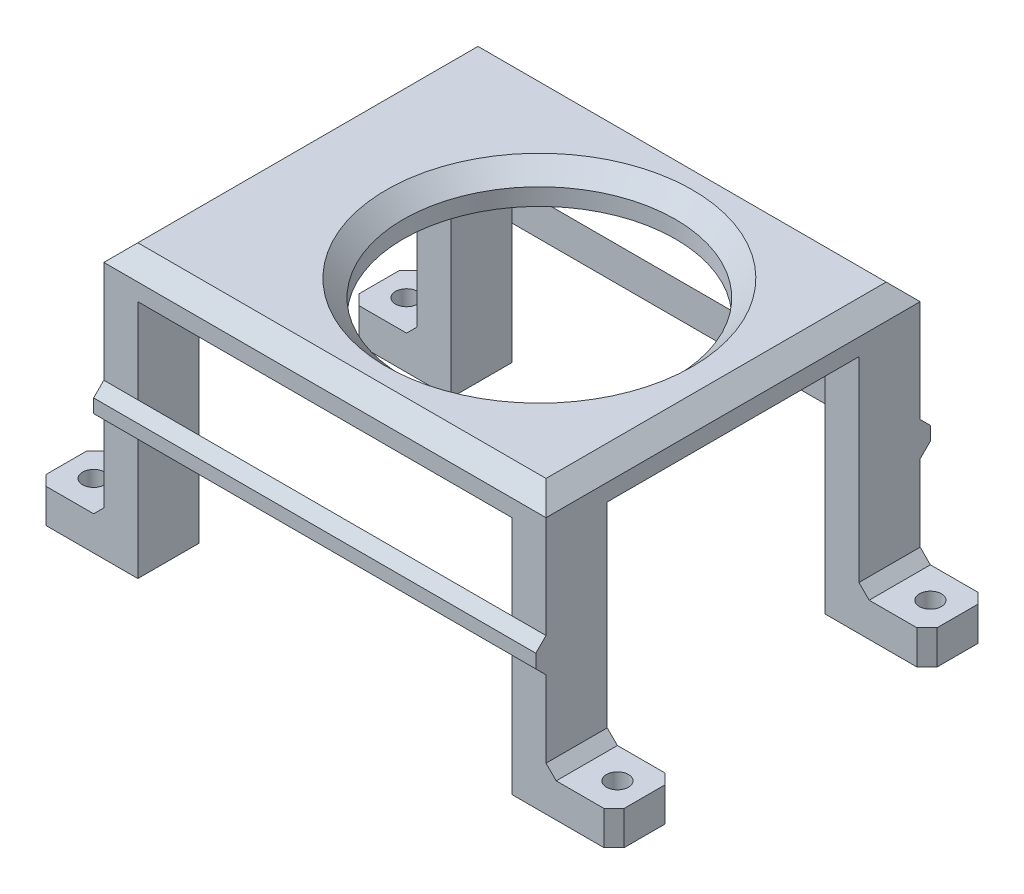
from build123d import *

# Parameters (mm, degrees)
BOSS_EXTRUDE2_DEPTH = 110
SKETCH4_W           = 74
SKETCH4_H           = 70.5
CUT_EXTRUDE2_DEPTH  = 218.899632859
CUT_EXTRUDE3_REACH  = 162.64
SKETCH5_R           = 40
CUT_EXTRUDE4_REACH  = 157.869
SKETCH6_R           = 3.25
SKETCH7_W           = 130
SKETCH7_H           = 10
BOSS_EXTRUDE3_DEPTH = 3
CHAMFER1_SIZE       = 3
CHAMFER2_SIZE       = 5
CHAMFER3_SIZE       = 3
CHAMFER5_SIZE       = 3


# Some blends are built 0.0001 mm under size
with BuildPart() as part:
    # Sketch3 → Boss-Extrude2 (new body)
    with BuildSketch(Plane.XY):
        Polygon((65, 10), (85, 10), (85, 0), (55, 0), (55, 70.5), (-55, 70.5), (-55, 0), (-85, 0), (-85, 10), (-65, 10), (-65, 80.5), (65, 80.5), align=None)
    extrude(amount=BOSS_EXTRUDE2_DEPTH)

    # Sketch4 → Cut-Extrude2 (cut, through all)
    with BuildSketch(Plane(origin=(85, 0, 0), x_dir=(0, 0, -1), z_dir=(1, 0, 0))):
        with Locations((-55, 35.25)):
            Rectangle(SKETCH4_W, SKETCH4_H)
    extrude(amount=-CUT_EXTRUDE2_DEPTH, mode=Mode.SUBTRACT)

    # Sketch5 → Cut-Extrude3 (cut, up to next)
    with BuildSketch(Plane(origin=(0, 80.5, 0), x_dir=(1, 0, 0), z_dir=(0, 1, 0)), mode=Mode.PRIVATE) as cut_extrude3_sk1:
        with Locations(Location((8.05, -55, 0), (0, 0, 180))):
            Circle(SKETCH5_R)
    cut_extrude3_tool1 = extrude(cut_extrude3_sk1.sketch, amount=-CUT_EXTRUDE3_REACH, mode=Mode.PRIVATE) & part.part
    add(cut_extrude3_tool1.solids().sort_by_distance((8.05, 80.5, 55))[0], mode=Mode.SUBTRACT)

    # Sketch6 → Cut-Extrude4 (cut, up to next)
    with BuildSketch(Plane(origin=(0, 10, 0), x_dir=(1, 0, 0), z_dir=(0, 1, 0)), mode=Mode.PRIVATE) as cut_extrude4_sk1:
        with Locations(Location((77, -101, 0), (0, 0, 270))):
            Circle(SKETCH6_R)
    cut_extrude4_tool1 = extrude(cut_extrude4_sk1.sketch, amount=-CUT_EXTRUDE4_REACH, mode=Mode.PRIVATE) & part.part
    # Sketch6 → Cut-Extrude4 (cut, up to next)
    with BuildSketch(Plane(origin=(0, 10, 0), x_dir=(1, 0, 0), z_dir=(0, 1, 0)), mode=Mode.PRIVATE) as cut_extrude4_sk2:
        with Locations(Location((77, -9, 0), (0, 0, 270))):
            Circle(SKETCH6_R)
    cut_extrude4_tool2 = extrude(cut_extrude4_sk2.sketch, amount=-CUT_EXTRUDE4_REACH, mode=Mode.PRIVATE) & part.part
    # Sketch6 → Cut-Extrude4 (cut, up to next)
    with BuildSketch(Plane(origin=(0, 10, 0), x_dir=(1, 0, 0), z_dir=(0, 1, 0)), mode=Mode.PRIVATE) as cut_extrude4_sk3:
        with Locations(Location((-77, -9, 0), (0, 0, 270))):
            Circle(SKETCH6_R)
    cut_extrude4_tool3 = extrude(cut_extrude4_sk3.sketch, amount=-CUT_EXTRUDE4_REACH, mode=Mode.PRIVATE) & part.part
    # Sketch6 → Cut-Extrude4 (cut, up to next)
    with BuildSketch(Plane(origin=(0, 10, 0), x_dir=(1, 0, 0), z_dir=(0, 1, 0)), mode=Mode.PRIVATE) as cut_extrude4_sk4:
        with Locations(Location((-77, -101, 0), (0, 0, 270))):
            Circle(SKETCH6_R)
    cut_extrude4_tool4 = extrude(cut_extrude4_sk4.sketch, amount=-CUT_EXTRUDE4_REACH, mode=Mode.PRIVATE) & part.part
    add(cut_extrude4_tool1.solids().sort_by_distance((77, 10, 101))[0], mode=Mode.SUBTRACT)
    add(cut_extrude4_tool2.solids().sort_by_distance((77, 10, 9))[0], mode=Mode.SUBTRACT)
    add(cut_extrude4_tool3.solids().sort_by_distance((-77, 10, 9))[0], mode=Mode.SUBTRACT)
    add(cut_extrude4_tool4.solids().sort_by_distance((-77, 10, 101))[0], mode=Mode.SUBTRACT)

    # Sketch7 → Boss-Extrude3 (add)
    with BuildSketch(Plane(origin=(0, 0, 0), x_dir=(-1, 0, 0), z_dir=(0, 0, -1))):
        with Locations((0, 40.5)):
            Rectangle(SKETCH7_W, SKETCH7_H)
    boss_extrude3 = extrude(amount=BOSS_EXTRUDE3_DEPTH)

    # Mirror1: Boss-Extrude3 across plane
    add(boss_extrude3.mirror(Plane.XY.offset(55)))

    # Chamfer1
    chamfer1_edges = [part.edges().sort_by_distance(p)[0] for p in [
        (0, 35.5, -3),
        (0, 45.5, -3),
    ]]
    chamfer(chamfer1_edges, length=CHAMFER1_SIZE - 0.0001)  # a hair under: the kernel refuses the full size

    # Chamfer2
    chamfer2_edges = [part.edges().sort_by_distance(p)[0] for p in [
        (0, 80.5, 0),
        (0, 80.5, 110),
        (-65, 80.5, 55),
        (65, 80.5, 55),
        (48.05, 80.5, 55),
    ]]
    chamfer(chamfer2_edges, length=CHAMFER2_SIZE)

    # Chamfer3
    # the kernel refuses this chamfer: 3 mm, written as the material it takes off along each edge
    with BuildSketch(Plane(origin=(-72.715048964, 35.5, 113), x_dir=(0, 0.9996219169112965, 0.02749587661058676), z_dir=(1, 0, 0))) as chamfer3_piece_1:
        Polygon((CHAMFER3_SIZE * 0.999621916911, -CHAMFER3_SIZE * 0.0274958766106), (-CHAMFER3_SIZE * 0.0274958766106, -CHAMFER3_SIZE * 0.999621916911), (0, 0), align=None)
    extrude(amount=145.430097928, mode=Mode.SUBTRACT)
    with BuildSketch(Plane(origin=(72.715048964, 45.5, 113), x_dir=(0, 0.027495876610586768, -0.9996219169112968), z_dir=(-1, 0, 0))) as chamfer3_piece_2:
        Polygon((CHAMFER3_SIZE * 0.999621916911, CHAMFER3_SIZE * 0.0274958766106), (-CHAMFER3_SIZE * 0.0274958766106, CHAMFER3_SIZE * 0.999621916911), (0, 0), align=None)
    extrude(amount=145.430097928, mode=Mode.SUBTRACT)

    # Chamfer5
    chamfer5_edges = [part.edges().sort_by_distance(p)[0] for p in [
        (-85, 5, 0),
        (85, 5, 0),
        (-65, 10, 101),
        (65, 10, 101),
        (-85, 5, 110),
        (-65, 10, 9),
        (65, 10, 9),
        (85, 5, 18),
        (-85, 5, 92),
        (-85, 5, 18),
        (85, 5, 92),
        (85, 5, 110),
    ]]
    chamfer(chamfer5_edges, length=CHAMFER5_SIZE)


solid = part.part
